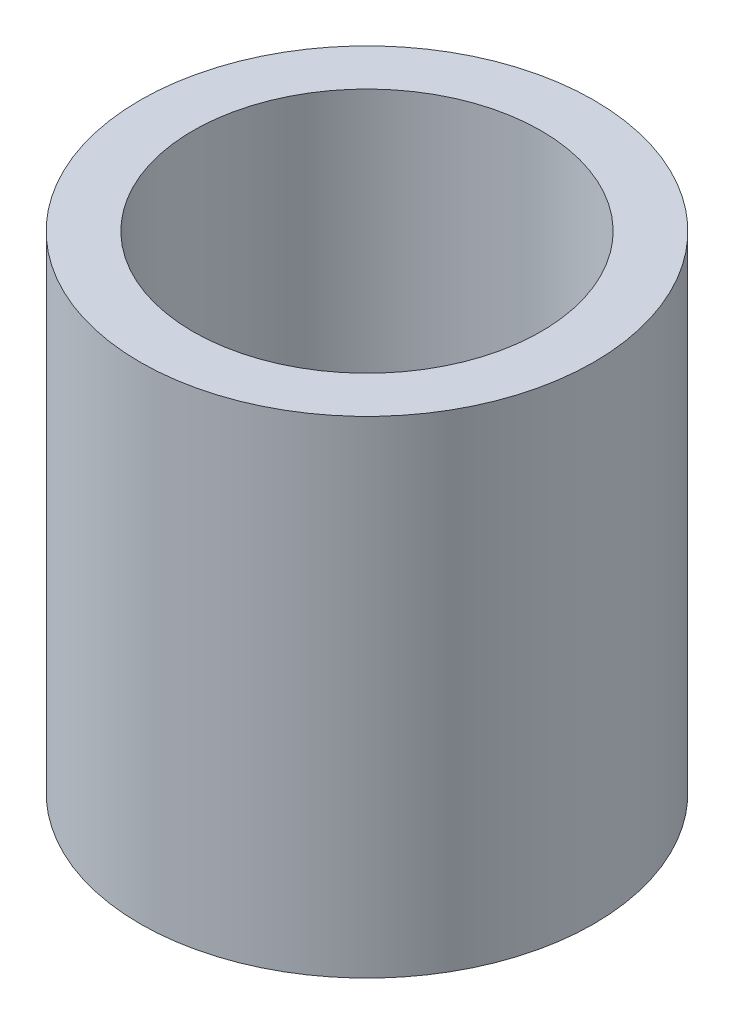
from build123d import *

# Parameters (mm, degrees)
SKETCH1_R           = 12.5
BOSS_EXTRUDE1_DEPTH = 26.799277764
SKETCH2_R           = 9.588797924
CUT_EXTRUDE1_DEPTH  = 33.104536886


with BuildPart() as part:
    # Sketch1 → Boss-Extrude1 (new body)
    with BuildSketch(Plane(origin=(0, 0, 0), x_dir=(1, 0, 0), z_dir=(0, 1, 0))):
        Circle(SKETCH1_R)
    extrude(amount=BOSS_EXTRUDE1_DEPTH)

    # Sketch2 → Cut-Extrude1 (cut, through all)
    with BuildSketch(Plane(origin=(0, 0, 0), x_dir=(1, 0, 0), z_dir=(0, 1, 0))):
        Circle(SKETCH2_R)
    extrude(amount=CUT_EXTRUDE1_DEPTH, mode=Mode.SUBTRACT)


solid = part.part
